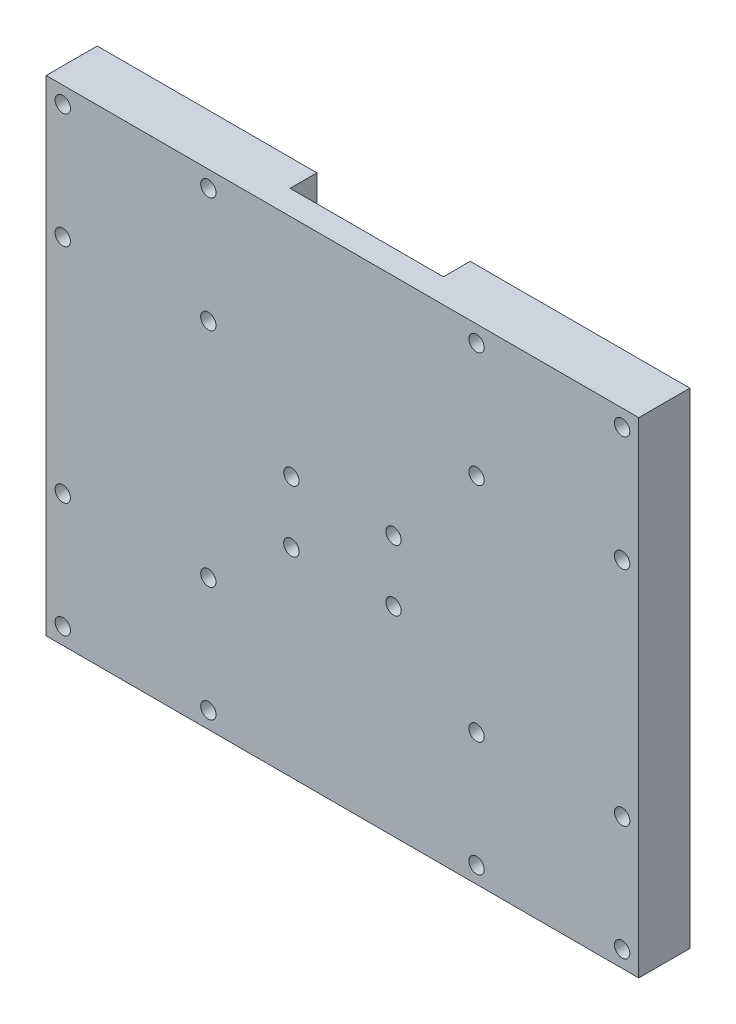
from build123d import *

# Parameters (mm, degrees)
SCHIZZO1_W                   = 232
SCHIZZO1_H                   = 190
ESTRUSIONE_ESTRUSIONE1_DEPTH = 20
SCHIZZO3_R                   = 3
TAGLIO_ESTRUSIONE1_DEPTH     = 152.26466871
SCHIZZO4_W                   = 60
SCHIZZO4_H                   = 10.5
TAGLIO_ESTRUSIONE2_DEPTH     = 224.508389104


with BuildPart() as part:
    # Schizzo1 → Estrusione-Estrusione1 (new body)
    with BuildSketch(Plane.XY):
        Rectangle(SCHIZZO1_W, SCHIZZO1_H)
    extrude(amount=ESTRUSIONE_ESTRUSIONE1_DEPTH)

    # Schizzo3 → Taglio-Estrusione1 (cut, through all)
    with BuildSketch(Plane.XY.offset(20)):
        with Locations((20, 7)):
            Circle(SCHIZZO3_R)
        with Locations((-20, 7)):
            Circle(SCHIZZO3_R)
        with Locations((-20, -17)):
            Circle(SCHIZZO3_R)
        with Locations((20, -17)):
            Circle(SCHIZZO3_R)
        with Locations((-109.5, 88.5)):
            Circle(SCHIZZO3_R)
        with Locations((-52.5, 88.5)):
            Circle(SCHIZZO3_R)
        with Locations((-109.5, 43.5)):
            Circle(SCHIZZO3_R)
        with Locations((-52.5, 43.5)):
            Circle(SCHIZZO3_R)
        with Locations((-109.5, -88.5)):
            Circle(SCHIZZO3_R)
        with Locations((-109.5, -43.5)):
            Circle(SCHIZZO3_R)
        with Locations((-52.5, -88.5)):
            Circle(SCHIZZO3_R)
        with Locations((-52.5, -43.5)):
            Circle(SCHIZZO3_R)
    taglio_estrusione1 = extrude(amount=-TAGLIO_ESTRUSIONE1_DEPTH, mode=Mode.SUBTRACT)

    # Schizzo4 → Taglio-Estrusione2 (cut, through all)
    with BuildSketch(Plane(origin=(0, 95, 0), x_dir=(1, 0, 0), z_dir=(0, 1, 0))):
        with Locations((0, -5.25)):
            Rectangle(SCHIZZO4_W, SCHIZZO4_H)
    extrude(amount=-TAGLIO_ESTRUSIONE2_DEPTH, mode=Mode.SUBTRACT)

    # Specchia1: Taglio-Estrusione1 across plane
    add(taglio_estrusione1.mirror(Plane(origin=(0, 0, 0), x_dir=(0, 0, 1), z_dir=(1, 0, 0))), mode=Mode.SUBTRACT)


solid = part.part
